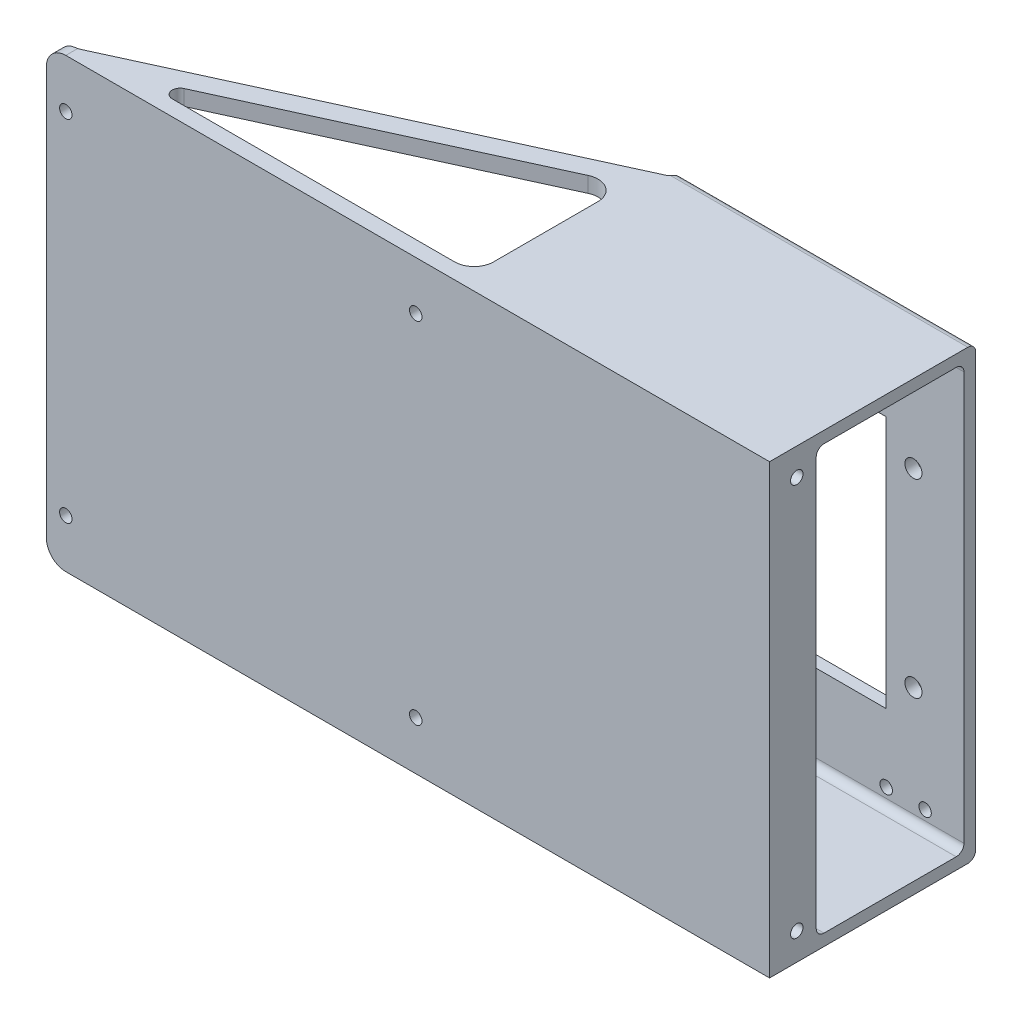
from build123d import *

# Parameters (mm, degrees)
SKETCH_2_W          = 76
SKETCH_2_H          = 115
SKETCH_2_R          = 2.2
SKETCH_2_R_2        = 1.6
EXTRUDE_1_DEPTH     = 3
EXTRUDE_2_DEPTH     = 76
SKETCH_4_W          = 47
SKETCH_4_H          = 108.999999999
EXTRUDE_3_DEPTH     = 3
SKETCH_5_W          = 12
SKETCH_5_H          = 115
SKETCH_5_R          = 1.6
EXTRUDE_4_DEPTH     = 3
FILLET_1_R          = 2
SKETCH_6_W          = 3
SKETCH_6_H          = 115
EXTRUDE_5_DEPTH     = 110
SKETCH_7_R          = 1.6
CUT_EXTRUDE_1_DEPTH = 110
FILLET_2_R          = 5
SKETCH_8_W          = 31
SKETCH_8_H          = 65
CUT_EXTRUDE_2_DEPTH = 3
EXTRUDE_6_DEPTH     = 4
EXTRUDE_7_DEPTH     = 4
FILLET_3_R          = 2
CUT_EXTRUDE_3_DEPTH = 124


with BuildPart() as part:
    # 草图2 → 凸台-拉伸1 (new body)
    with BuildSketch(Plane.XY):
        with Locations((61.052848474, -66.98174403)):
            Rectangle(SKETCH_2_W, SKETCH_2_H)
        with Locations((86.052848474, -91.272111932)):
            Circle(SKETCH_2_R, mode=Mode.SUBTRACT)
        with Locations((86.052848474, -42.48174403)):
            Circle(SKETCH_2_R, mode=Mode.SUBTRACT)
        with Locations((37.262480572, -42.48174403)):
            Circle(SKETCH_2_R, mode=Mode.SUBTRACT)
        with Locations((37.262480572, -91.272111932)):
            Circle(SKETCH_2_R, mode=Mode.SUBTRACT)
        with Locations((89.052848474, -16.98174403)):
            Circle(SKETCH_2_R_2, mode=Mode.SUBTRACT)
        with Locations((79.052848474, -16.98174403)):
            Circle(SKETCH_2_R_2, mode=Mode.SUBTRACT)
        with Locations((41.052848474, -16.98174403)):
            Circle(SKETCH_2_R_2, mode=Mode.SUBTRACT)
        with Locations((51.052848474, -16.98174403)):
            Circle(SKETCH_2_R_2, mode=Mode.SUBTRACT)
        with Locations((41.052848474, -116.98174403)):
            Circle(SKETCH_2_R_2, mode=Mode.SUBTRACT)
        with Locations((51.052848474, -116.98174403)):
            Circle(SKETCH_2_R_2, mode=Mode.SUBTRACT)
        with Locations((79.052848474, -116.98174403)):
            Circle(SKETCH_2_R_2, mode=Mode.SUBTRACT)
        with Locations((89.052848474, -116.98174403)):
            Circle(SKETCH_2_R_2, mode=Mode.SUBTRACT)
    extrude(amount=EXTRUDE_1_DEPTH)

    # 草图3 → 凸台-拉伸2 (add)
    with BuildSketch(Plane.ZY.offset(-23.052848474)):
        Polygon((0, -9.48174403), (53, -9.48174403), (53, -124.48174403), (0, -124.48174403), (0, -121.48174403), (50, -121.48174403), (50, -12.481744031), (0, -12.481744031), align=None)
    extrude(amount=-EXTRUDE_2_DEPTH)

    # 草图4 → 凸台-拉伸3 (add)
    with BuildSketch(Plane.ZY.offset(-23.052848474)):
        with Locations((26.5, -66.98174403)):
            Rectangle(SKETCH_4_W, SKETCH_4_H)
    extrude(amount=-EXTRUDE_3_DEPTH)

    # 草图5 → 凸台-拉伸4 (add)
    with BuildSketch(Plane(origin=(99.052848474, 0, 0), x_dir=(0, 0, -1), z_dir=(1, 0, 0))):
        with Locations((-47, -66.98174403)):
            Rectangle(SKETCH_5_W, SKETCH_5_H)
        with Locations((-46, -117.48174403)):
            Circle(SKETCH_5_R, mode=Mode.SUBTRACT)
        with Locations((-46, -16.48174403)):
            Circle(SKETCH_5_R, mode=Mode.SUBTRACT)
    extrude(amount=-EXTRUDE_4_DEPTH)

    # 圆角1
    fillet_1_edges = [part.edges().sort_by_distance(p)[0] for p in [
        (97.552848474, -121.48174403, 41),
        (97.552848474, -12.481744031, 41),
        (61.052848474, -12.481744031, 50),
        (61.052848474, -121.48174403, 50),
        (62.552848474, -121.48174403, 3),
        (61.052848474, -124.48174403, 0),
        (61.052848474, -9.48174403, 0),
        (62.552848474, -12.481744031, 3),
    ]]
    fillet(fillet_1_edges, radius=FILLET_1_R)

    # 草图6 → 凸台-拉伸5 (add)
    with BuildSketch(Plane.ZY.offset(-23.052848474)):
        with Locations((51.5, -66.98174403)):
            Rectangle(SKETCH_6_W, SKETCH_6_H)
    extrude(amount=EXTRUDE_5_DEPTH)

    # 草图7 → 切除-拉伸1 (cut)
    with BuildSketch(Plane(origin=(0, 0, 50), x_dir=(-1, 0, 0), z_dir=(0, 0, -1))):
        with Locations((81.947151526, -21.98174403)):
            Circle(SKETCH_7_R)
        with Locations((81.947151526, -111.98174403)):
            Circle(SKETCH_7_R)
        with Locations((-8.052848474, -21.98174403)):
            Circle(SKETCH_7_R)
        with Locations((-8.052848474, -111.98174403)):
            Circle(SKETCH_7_R)
    extrude(amount=-CUT_EXTRUDE_1_DEPTH, mode=Mode.SUBTRACT)

    # 圆角2
    fillet_2_edges = [part.edges().sort_by_distance(p)[0] for p in [
        (-86.947151526, -9.48174403, 51.5),
        (-86.947151526, -124.48174403, 51.5),
    ]]
    fillet(fillet_2_edges, radius=FILLET_2_R)

    # 草图8 → 切除-拉伸2 (cut)
    with BuildSketch(Plane(origin=(0, 0, 0), x_dir=(-1, 0, 0), z_dir=(0, 0, -1))):
        with Locations((-63.552848474, -66.98174403)):
            Rectangle(SKETCH_8_W, SKETCH_8_H)
    extrude(amount=-CUT_EXTRUDE_2_DEPTH, mode=Mode.SUBTRACT)

    # 草图9 → 凸台-拉伸6 (add)
    with BuildSketch(Plane(origin=(0, -124.48174403, 0), x_dir=(-1, 0, 0), z_dir=(0, -1, 0))):
        Polygon((-23.052848474, -2), (81.947151526, -50), (-23.052848474, -50), align=None)
    extrude(amount=-EXTRUDE_6_DEPTH)

    # 草图10 → 凸台-拉伸7 (add)
    with BuildSketch(Plane(origin=(0, -9.48174403, 0), x_dir=(1, 0, 0), z_dir=(0, 1, 0))):
        Polygon((23.052848474, -2), (-81.947151526, -50), (23.052848474, -50), align=None)
    extrude(amount=-EXTRUDE_7_DEPTH)

    # 圆角3
    fillet_3_edges = [part.edges().sort_by_distance(p)[0] for p in [
        (-81.947151526, -11.48174403, 50),
        (-81.947151526, -122.48174403, 50),
        (23.052848474, -122.48174403, 2),
        (23.052848474, -11.48174403, 2),
        (-29.447151526, -13.48174403, 50),
        (23.052848474, -13.48174403, 26),
        (23.052848474, -66.98174403, 50),
        (-29.447151526, -120.48174403, 50),
        (23.052848474, -120.48174403, 26),
    ]]
    fillet(fillet_3_edges, radius=FILLET_3_R)

    # 草图11 → 切除-拉伸3 (cut)
    with BuildSketch(Plane(origin=(0, -124.48174403, 0), x_dir=(-1, 0, 0), z_dir=(0, -1, 0))):
        with BuildLine():
            Line((58.548005297, -49), (-14.052848474, -49))
            ThreePointArc((-14.052848474, -49), (-17.58838238, -47.535533906), (-19.052848474, -44))
            Line((-19.052848474, -44), (-19.052848474, -17.109646517))
            ThreePointArc((-19.052848474, -17.109646517), (-16.755255364, -12.902866632), (-11.974049673, -12.562274139))
            Line((-11.974049673, -12.562274139), (59.379524817, -45.181051049))
            ThreePointArc((59.379524817, -45.181051049), (60.502218425, -47.425500939), (58.548005297, -49))
        make_face()
    extrude(amount=-CUT_EXTRUDE_3_DEPTH, mode=Mode.SUBTRACT)


solid = part.part
